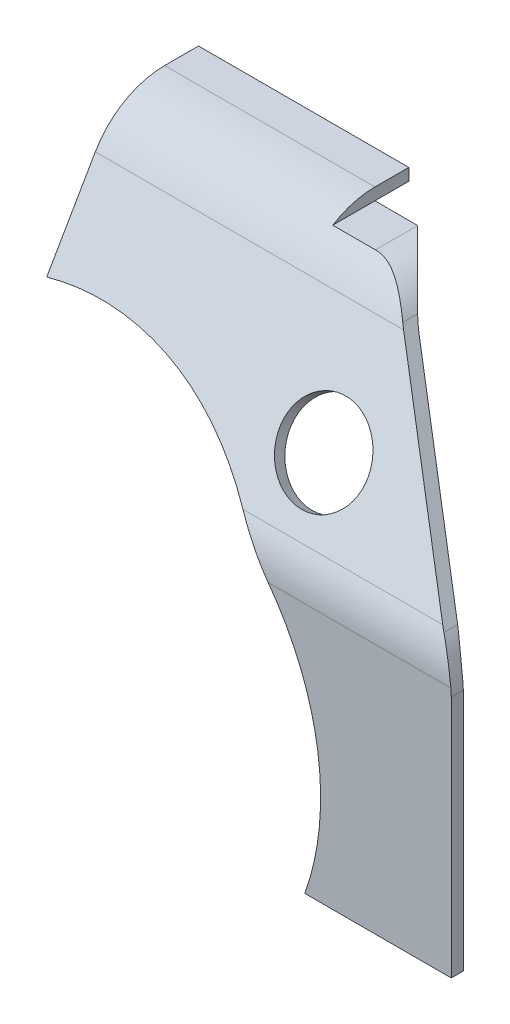
from build123d import *

# Parameters (mm, degrees)
SALIENTE_EXTRUIR1_DEPTH = 58.05
REDONDEO1_R             = 20
REDONDEO2_R             = 20
REDONDEO3_R             = 17
REDONDEO4_R             = 17
CAVIDAD1_START          = -47
CAVIDAD1_DEPTH          = 50
CROQUIS16_R             = 67.5
CORTAR_EXTRUIR11_DEPTH  = 143.339628461
CROQUIS18_R             = 11
CORTAR_EXTRUIR12_DEPTH  = 142.06007654


# Read off the part's stored shape, not the designer's step: Cavidad1
with BuildPart() as part:
    # Croquis1 → Saliente-Extruir1 (new, symmetric)
    with BuildSketch(Plane(origin=(0, 0, 0), x_dir=(0, 0, -1), z_dir=(1, 0, 0))):
        Polygon((0, 0), (0, 67.196152423), (28.732050808, 116.961524227), (47, 116.961524227), (47, 119.961524227), (27, 119.961524227), (-3, 68), (-3, 0), align=None)
    extrude(amount=SALIENTE_EXTRUIR1_DEPTH, both=True)

    # Redondeo1
    redondeo1_edges = [part.edges().sort_by_distance(p)[0] for p in [
        (0, 68, 3),
    ]]
    fillet(redondeo1_edges, radius=REDONDEO1_R)

    # Redondeo2
    redondeo2_edges = [part.edges().sort_by_distance(p)[0] for p in [
        (0, 119.961524227, -27),
    ]]
    fillet(redondeo2_edges, radius=REDONDEO2_R)

    # Redondeo3
    redondeo3_edges = [part.edges().sort_by_distance(p)[0] for p in [
        (0, 116.961524227, -28.732050808),
    ]]
    fillet(redondeo3_edges, radius=REDONDEO3_R)

    # Redondeo4
    redondeo4_edges = [part.edges().sort_by_distance(p)[0] for p in [
        (0, 67.196152423, 0),
    ]]
    fillet(redondeo4_edges, radius=REDONDEO4_R)

    # Cavidad1 outline → Cavidad1 (cut)
    with BuildSketch(Plane.XY.offset(CAVIDAD1_START)):
        with BuildLine():
            Line((58.05, 0), (58.05, 119.961524227))
            Line((58.05, 119.961524227), (-5.55, 119.961524227))
            Line((-5.55, 119.961524227), (-5.55, 116.961524227))
            Line((-5.55, 116.961524227), (5.123846837, 116.961524227))
            ThreePointArc((5.123846837, 116.961524227), (12.308357287, 115.368756607), (18.14660237, 110.888913592))
            Line((18.14660237, 110.888913592), (51.073651347, 71.647984679))
            ThreePointArc((51.073651347, 71.647984679), (54.025670368, 66.534937751), (55.050895814, 60.720595315))
            Line((55.050895814, 60.720595315), (55.050895814, 0))
            Line((55.050895814, 0), (58.05, 0))
        make_face()
    extrude(amount=CAVIDAD1_DEPTH, mode=Mode.SUBTRACT)

    # Croquis16 → Cortar-Extruir11 (cut, through all)
    with BuildSketch(Plane.XY.offset(3)):
        with Locations((-45.071920691, 22.721524227)):
            Circle(CROQUIS16_R)
    extrude(amount=-CORTAR_EXTRUIR11_DEPTH, mode=Mode.SUBTRACT)

    # Croquis18 → Cortar-Extruir12 (cut, through all)
    with BuildSketch(Plane(origin=(0, 18.299038106, 31.694863729), x_dir=(1, 0, 0), z_dir=(0, 0.4999999999999976, 0.86602540378444))):
        with Locations(Location((12.350895814, 79.099876042, 0), (0, 0, 270))):
            Circle(CROQUIS18_R)
    extrude(amount=-CORTAR_EXTRUIR12_DEPTH, mode=Mode.SUBTRACT)


solid = part.part
